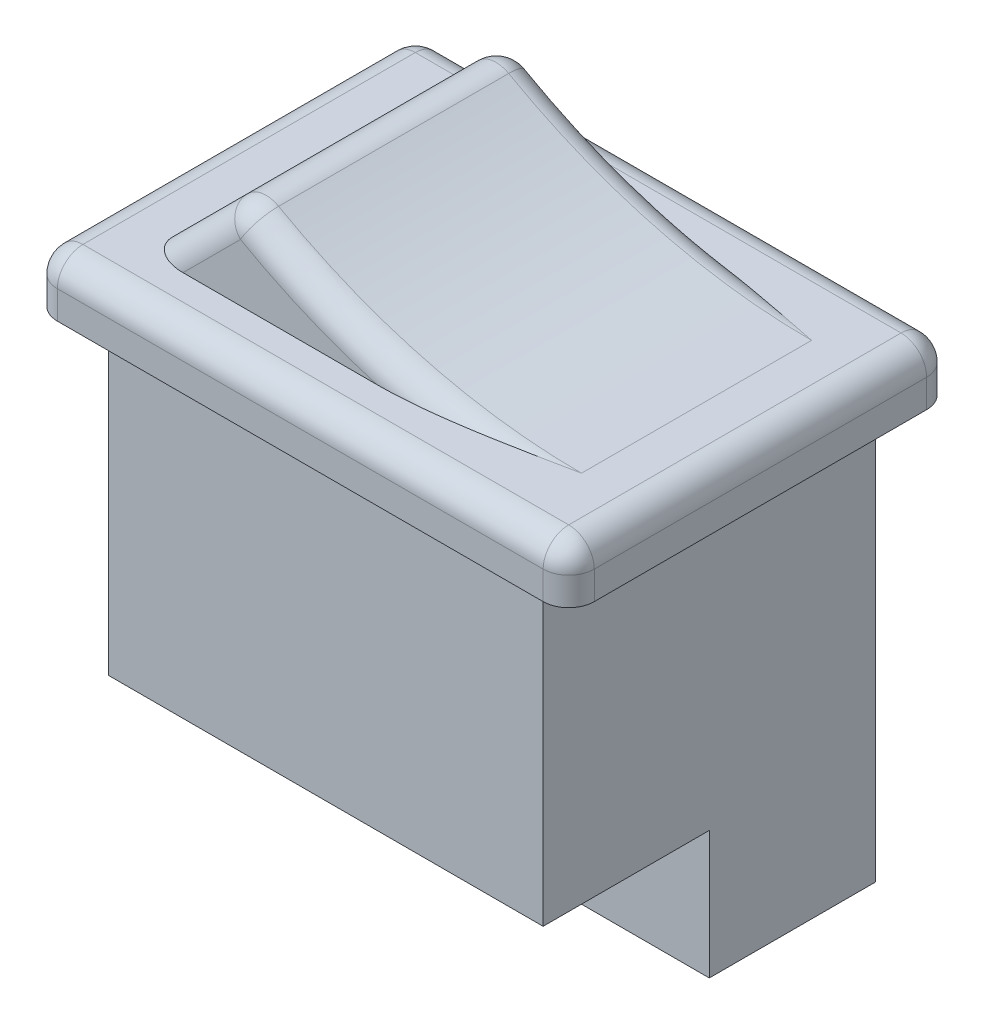
from build123d import *

# Parameters (mm, degrees)
SKETCH_1_W      = 21
SKETCH_1_H      = 15
EXTRUDE_1_DEPTH = 2.1
EXTRUDE_2_DEPTH = 5.5
FILLET_1_R      = 1
SKETCH_3_W      = 17
SKETCH_3_H      = 13
EXTRUDE_3_DEPTH = 12
FILLET_2_R      = 1
SKETCH_4_W      = 17
SKETCH_4_H      = 6.5
EXTRUDE_4_DEPTH = 5


with BuildPart() as part:
    # ｽｹｯﾁ1 → ﾎﾞｽ - 押し出し1 (new body)
    with BuildSketch(Plane(origin=(0, 0, 0), x_dir=(1, 0, 0), z_dir=(0, 1, 0))):
        Rectangle(SKETCH_1_W, SKETCH_1_H)
    extrude(amount=EXTRUDE_1_DEPTH)

    # ｽｹｯﾁ2 → ﾎﾞｽ - 押し出し2 (add, symmetric)
    with BuildSketch(Plane.XY):
        with BuildLine():
            Line((-8, 2.1), (-4.5, 5.6))
            ThreePointArc((-4.5, 5.6), (1.509622507, 2.991508954), (8, 2.1))
            Line((8, 2.1), (-8, 2.1))
        make_face()
    extrude(amount=EXTRUDE_2_DEPTH, both=True)

    # ﾌｨﾚｯﾄ1
    fillet_1_edges = [part.edges().sort_by_distance(p)[0] for p in [
        (-4.5, 5.6, 0),
    ]]
    fillet(fillet_1_edges, radius=FILLET_1_R)
    fillet_1_2_edges = [part.edges().sort_by_distance(p)[0] for p in [
        (1.874891199, 2.892323871, -5.5),
    ]]
    fillet(fillet_1_2_edges, radius=FILLET_1_R)
    fillet_1_3_edges = [part.edges().sort_by_distance(p)[0] for p in [
        (1.874891199, 2.892323871, 5.5),
    ]]
    fillet(fillet_1_3_edges, radius=FILLET_1_R)

    # ｽｹｯﾁ3 → ﾎﾞｽ - 押し出し3 (add)
    with BuildSketch(Plane.XZ):
        Rectangle(SKETCH_3_W, SKETCH_3_H)
    extrude(amount=EXTRUDE_3_DEPTH)

    # ﾌｨﾚｯﾄ2
    fillet_2_edges = [part.edges().sort_by_distance(p)[0] for p in [
        (-10.5, 1.05, 7.5),
        (-10.5, 1.05, -7.5),
        (10.5, 1.05, -7.5),
        (10.5, 1.05, 7.5),
        (-10.5, 2.1, 0),
        (0, 2.1, -7.5),
        (10.5, 2.1, 0),
        (0, 2.1, 7.5),
    ]]
    fillet(fillet_2_edges, radius=FILLET_2_R)

    # ｽｹｯﾁ4 → ﾎﾞｽ - 押し出し4 (add)
    with BuildSketch(Plane.XZ.offset(12)):
        with Locations((0, -3.25)):
            Rectangle(SKETCH_4_W, SKETCH_4_H)
    extrude(amount=EXTRUDE_4_DEPTH)


solid = part.part
